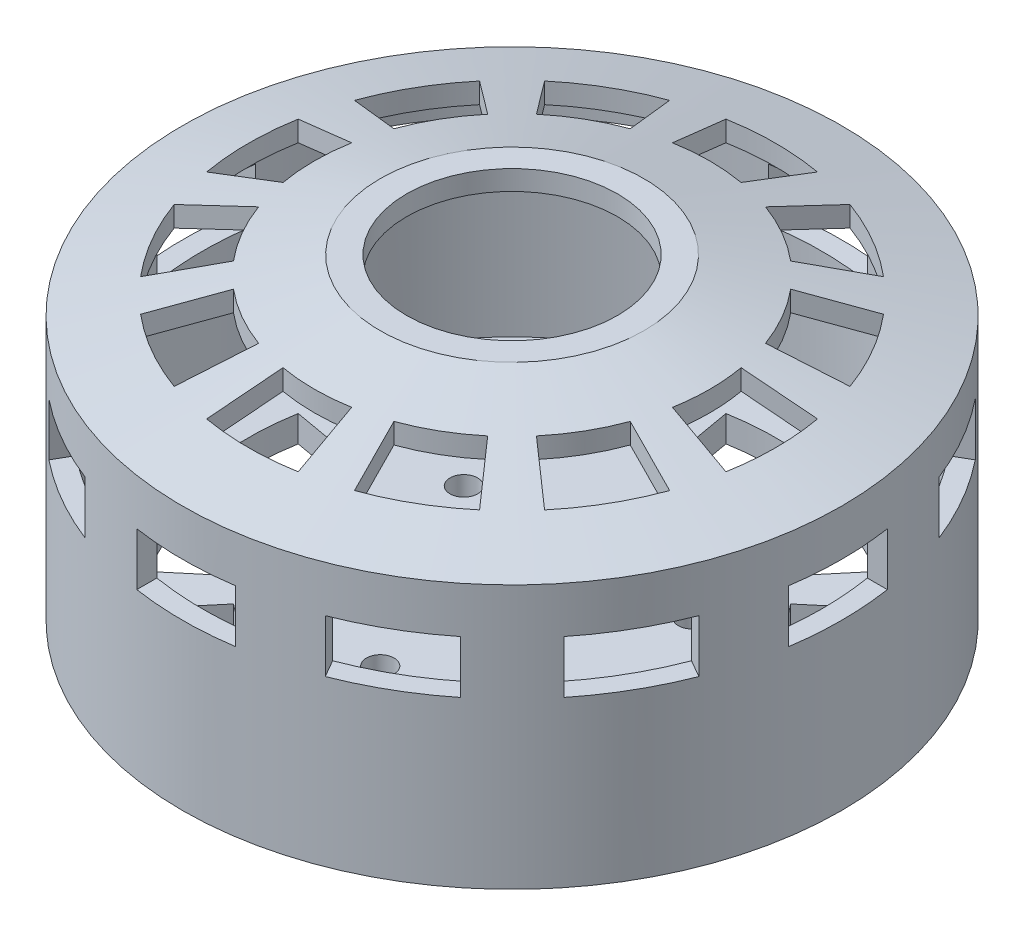
from build123d import *

# Parameters (mm, degrees)
SKETCH_1_R                  = 50
EXTRUDE_1_DEPTH             = 4
HOLE_WIZARD_M42_D           = 4.2
HOLE_WIZARD_M42_CSINK_D     = 5
HOLE_WIZARD_M42_CSINK_ANGLE = 90
CUT_EXTRUDE_1_DEPTH         = 86.485058078
SKETCH_11_W                 = 15
SKETCH_11_H                 = 8
CUT_EXTRUDE_2_DEPTH         = 86.485058251
PATTERN_CIRCULAR_1_COUNT    = 12


with BuildPart() as part:
    # Эскиз1 → Бобышка-Вытянуть1 (new body)
    with BuildSketch(Plane(origin=(0, 0, 0), x_dir=(1, 0, 0), z_dir=(0, 1, 0))):
        Circle(SKETCH_1_R)
    extrude(amount=EXTRUDE_1_DEPTH)

    # Сверло под метчик  спиральное M42 (through all)
    with Locations(Plane(origin=(0, 0, 0), x_dir=(-1, 0, 0), z_dir=(0, -1, 0))):
        with Locations((17.320508076, 10), (0, 20), (17.320508076, -10), (0, -20), (-17.320508076, -10), (-17.320508076, 10)):
            CounterSinkHole(HOLE_WIZARD_M42_D / 2, HOLE_WIZARD_M42_CSINK_D / 2, counter_sink_angle=HOLE_WIZARD_M42_CSINK_ANGLE)

    # Эскиз7 → Повернуть1 (revolve)
    with BuildSketch(Plane.XY):
        Polygon((47, 4), (50, 4), (50, 40), (20, 48.038475773), (16, 48.038475773), (16, 45.038475773), (19.605042507, 45.038475773), (47, 37.698019036), align=None)
    revolve(axis=Axis((0, -1000, 0), (0, 1, 0)))

    # Эскиз4 → Вырез-Вытянуть1 (cut, through all)
    with BuildSketch(Plane.XZ):
        with BuildLine():
            Line((-6.945927107, 39.39231012), (-5.20944533, 29.54423259))
            ThreePointArc((-5.20944533, 29.54423259), (0, 30), (5.20944533, 29.54423259))
            Line((5.20944533, 29.54423259), (6.945927107, 39.39231012))
            ThreePointArc((6.945927107, 39.39231012), (0, 40), (-6.945927107, 39.39231012))
        make_face()
        with BuildLine():
            Line((13.680805733, 37.587704831), (10.2606043, 28.190778624))
            ThreePointArc((10.2606043, 28.190778624), (15, 25.980762114), (19.283628291, 22.981333294))
            Line((19.283628291, 22.981333294), (25.711504387, 30.641777725))
            ThreePointArc((25.711504387, 30.641777725), (20, 34.641016151), (13.680805733, 37.587704831))
        make_face()
        with BuildLine():
            Line((30.641777725, 25.711504387), (22.981333294, 19.283628291))
            ThreePointArc((22.981333294, 19.283628291), (25.980762114, 15), (28.190778624, 10.2606043))
            Line((28.190778624, 10.2606043), (37.587704831, 13.680805733))
            ThreePointArc((37.587704831, 13.680805733), (34.641016151, 20), (30.641777725, 25.711504387))
        make_face()
        with BuildLine():
            Line((39.39231012, 6.945927107), (29.54423259, 5.20944533))
            ThreePointArc((29.54423259, 5.20944533), (30, 0), (29.54423259, -5.20944533))
            Line((29.54423259, -5.20944533), (39.39231012, -6.945927107))
            ThreePointArc((39.39231012, -6.945927107), (40, 0), (39.39231012, 6.945927107))
        make_face()
        with BuildLine():
            Line((37.587704831, -13.680805733), (28.190778624, -10.2606043))
            ThreePointArc((28.190778624, -10.2606043), (25.980762114, -15), (22.981333294, -19.283628291))
            Line((22.981333294, -19.283628291), (30.641777725, -25.711504387))
            ThreePointArc((30.641777725, -25.711504387), (34.641016151, -20), (37.587704831, -13.680805733))
        make_face()
        with BuildLine():
            Line((25.711504387, -30.641777725), (19.283628291, -22.981333294))
            ThreePointArc((19.283628291, -22.981333294), (15, -25.980762114), (10.2606043, -28.190778624))
            Line((10.2606043, -28.190778624), (13.680805733, -37.587704831))
            ThreePointArc((13.680805733, -37.587704831), (20, -34.641016151), (25.711504387, -30.641777725))
        make_face()
        with BuildLine():
            Line((6.945927107, -39.39231012), (5.20944533, -29.54423259))
            ThreePointArc((5.20944533, -29.54423259), (0, -30), (-5.20944533, -29.54423259))
            Line((-5.20944533, -29.54423259), (-6.945927107, -39.39231012))
            ThreePointArc((-6.945927107, -39.39231012), (0, -40), (6.945927107, -39.39231012))
        make_face()
        with BuildLine():
            Line((-13.680805733, -37.587704831), (-10.2606043, -28.190778624))
            ThreePointArc((-10.2606043, -28.190778624), (-15, -25.980762114), (-19.283628291, -22.981333294))
            Line((-19.283628291, -22.981333294), (-25.711504387, -30.641777725))
            ThreePointArc((-25.711504387, -30.641777725), (-20, -34.641016151), (-13.680805733, -37.587704831))
        make_face()
        with BuildLine():
            Line((-30.641777725, -25.711504387), (-22.981333294, -19.283628291))
            ThreePointArc((-22.981333294, -19.283628291), (-25.980762114, -15), (-28.190778624, -10.2606043))
            Line((-28.190778624, -10.2606043), (-37.587704831, -13.680805733))
            ThreePointArc((-37.587704831, -13.680805733), (-34.641016151, -20), (-30.641777725, -25.711504387))
        make_face()
        with BuildLine():
            Line((-39.39231012, -6.945927107), (-29.54423259, -5.20944533))
            ThreePointArc((-29.54423259, -5.20944533), (-30, 0), (-29.54423259, 5.20944533))
            Line((-29.54423259, 5.20944533), (-39.39231012, 6.945927107))
            ThreePointArc((-39.39231012, 6.945927107), (-40, 0), (-39.39231012, -6.945927107))
        make_face()
        with BuildLine():
            Line((-37.587704831, 13.680805733), (-28.190778624, 10.2606043))
            ThreePointArc((-28.190778624, 10.2606043), (-25.980762114, 15), (-22.981333294, 19.283628291))
            Line((-22.981333294, 19.283628291), (-30.641777725, 25.711504387))
            ThreePointArc((-30.641777725, 25.711504387), (-34.641016151, 20), (-37.587704831, 13.680805733))
        make_face()
        with BuildLine():
            Line((-25.711504387, 30.641777725), (-19.283628291, 22.981333294))
            ThreePointArc((-19.283628291, 22.981333294), (-15, 25.980762114), (-10.2606043, 28.190778624))
            Line((-10.2606043, 28.190778624), (-13.680805733, 37.587704831))
            ThreePointArc((-13.680805733, 37.587704831), (-20, 34.641016151), (-25.711504387, 30.641777725))
        make_face()
    extrude(amount=-CUT_EXTRUDE_1_DEPTH, mode=Mode.SUBTRACT)

    # Эскиз11 → Вырез-Вытянуть2 (cut, through all)
    with BuildSketch(Plane(origin=(0, 0, 0), x_dir=(0, 0, -1), z_dir=(1, 0, 0))):
        with Locations((0, 29)):
            Rectangle(SKETCH_11_W, SKETCH_11_H)
    cut_extrude_2 = extrude(amount=-CUT_EXTRUDE_2_DEPTH, mode=Mode.SUBTRACT)

    # Круговой массив1: Вырез-Вытянуть2 ×12 about axis
    pattern_circular_1_axis = Axis((0, -1000, 0), (0, 1, 0))
    for i in range(1, PATTERN_CIRCULAR_1_COUNT):
        add(cut_extrude_2.rotate(pattern_circular_1_axis, i * 360 / PATTERN_CIRCULAR_1_COUNT), mode=Mode.SUBTRACT)


solid = part.part
